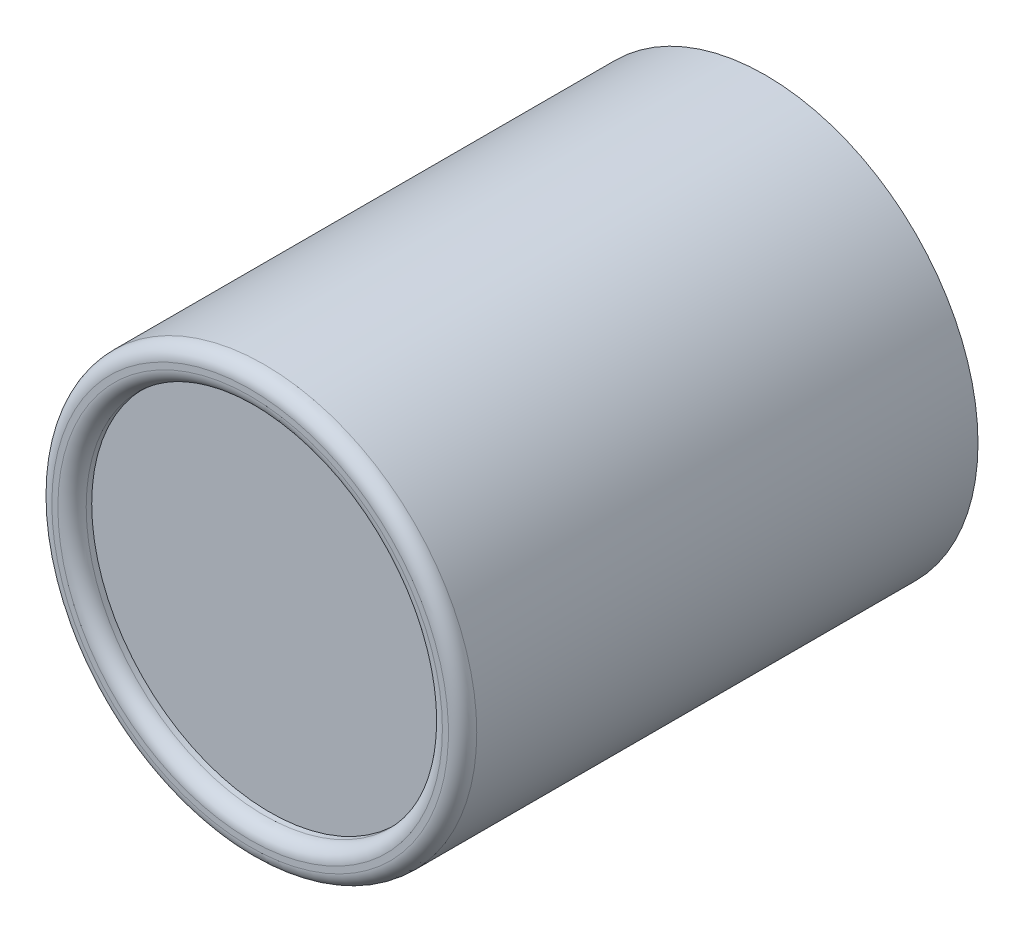
from build123d import *

# Parameters (mm, degrees)
BOSS_EXTRUDE1_START = -1
SKETCH3_R           = 0.75
BOSS_EXTRUDE1_DEPTH = 1


with BuildPart() as part:
    # Sketch2 → Revolve1 (revolve)
    with BuildSketch(Plane(origin=(0, 0, 0), x_dir=(0, 0, -1), z_dir=(1, 0, 0))):
        with BuildLine():
            Line((0, 0.75), (0, 0))
            Line((0, 0), (-0.75, 0))
            Line((-0.75, 0), (-0.75, 0.628768743))
            Line((-0.75, 0.628768743), (-0.769458866, 0.628768743))
            ThreePointArc((-0.769458866, 0.628768743), (-0.804814205, 0.643413404), (-0.819458866, 0.678768743))
            Line((-0.819458866, 0.678768743), (-0.819458866, 0.7))
            ThreePointArc((-0.819458866, 0.7), (-0.804814205, 0.735355339), (-0.769458866, 0.75))
            Line((-0.769458866, 0.75), (0, 0.75))
        make_face()
    revolve(axis=Axis((0, 0, 0), (0, 0, 1)))

    # Sketch3 → Boss-Extrude1 (add)
    with BuildSketch(Plane.XY.offset(BOSS_EXTRUDE1_START)):
        Circle(SKETCH3_R)
    extrude(amount=BOSS_EXTRUDE1_DEPTH)


solid = part.part
